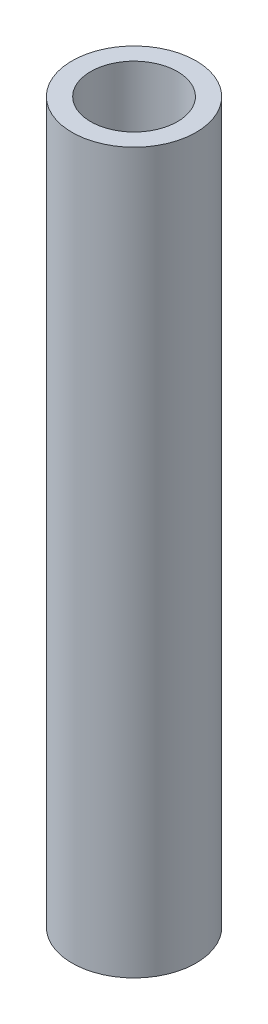
from build123d import *

# Parameters (mm, degrees)
SKETCH1_R           = 5
SKETCH1_R_2         = 3.5
BOSS_EXTRUDE1_DEPTH = 29


with BuildPart() as part:
    # Sketch1 → Boss-Extrude1 (new, symmetric)
    with BuildSketch(Plane(origin=(0, 0, 0), x_dir=(1, 0, 0), z_dir=(0, 1, 0))):
        Circle(SKETCH1_R)
        Circle(SKETCH1_R_2, mode=Mode.SUBTRACT)
    extrude(amount=BOSS_EXTRUDE1_DEPTH, both=True)


solid = part.part
